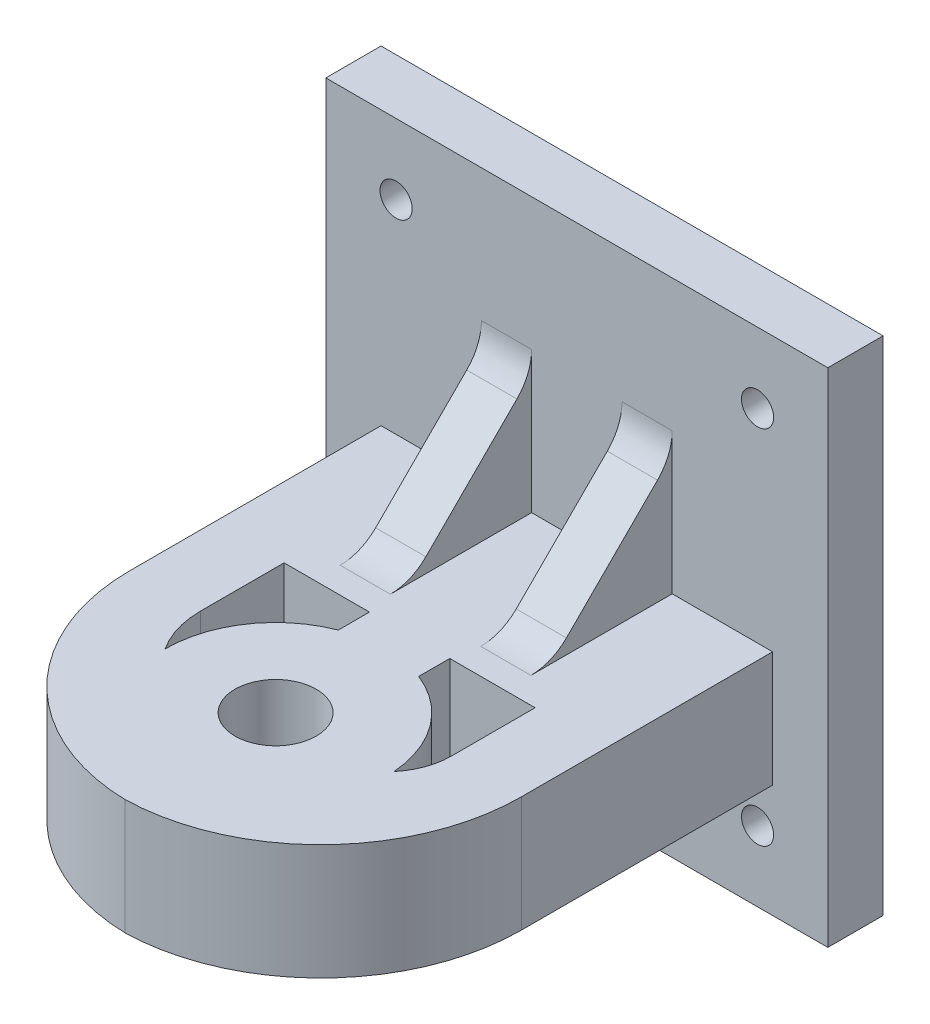
from build123d import *

# Parameters (mm, degrees)
SKETCH1_W           = 39
SKETCH1_H           = 45
BOSS_EXTRUDE1_DEPTH = 12.5
SKETCH2_R           = 4.05
CUT_EXTRUDE1_DEPTH  = 61.846117378
SKETCH3_W           = 50
SKETCH3_H           = 50
BOSS_EXTRUDE2_DEPTH = 5.5
BOSS_EXTRUDE3_START = -10
BOSS_EXTRUDE3_DEPTH = 5
LPATTERN1_COUNT     = 2
LPATTERN1_PITCH     = 14
FILLET1_R           = 5
SKETCH5_R           = 1.6
CUT_EXTRUDE2_DEPTH  = 79.17008699
FILLET2_R           = 20
CUT_EXTRUDE3_DEPTH  = 73.615855707
CUT_EXTRUDE4_START  = -1
SKETCH7_W           = 39.2
SKETCH7_H           = 50.063664736
SKETCH7_R           = 11
SKETCH7_W_2         = 11
SKETCH7_H_2         = 11
CUT_EXTRUDE4_DEPTH  = 1
SKETCH8_W           = 25
SKETCH8_H           = 5
SKETCH8_W_2         = 5
SKETCH8_H_2         = 25
BOSS_EXTRUDE4_DEPTH = 0.5


with BuildPart() as part:
    # Sketch1 → Boss-Extrude1 (new body)
    with BuildSketch(Plane(origin=(0, 0, 0), x_dir=(1, 0, 0), z_dir=(0, 1, 0))):
        with Locations((19.5, 22.5)):
            Rectangle(SKETCH1_W, SKETCH1_H)
    extrude(amount=BOSS_EXTRUDE1_DEPTH)

    # Sketch2 → Cut-Extrude1 (cut, through all)
    with BuildSketch(Plane(origin=(0, 12.5, 0), x_dir=(1, 0, 0), z_dir=(0, 1, 0))):
        with Locations(Location((19.5, 15, 0), (0, 0, 270))):
            Circle(SKETCH2_R)
    extrude(amount=-CUT_EXTRUDE1_DEPTH, mode=Mode.SUBTRACT)

    # Sketch3 → Boss-Extrude2 (add)
    with BuildSketch(Plane(origin=(0, 0, -45), x_dir=(-1, 0, 0), z_dir=(0, 0, -1))):
        with Locations((-19.5, 14.75)):
            Rectangle(SKETCH3_W, SKETCH3_H)
    extrude(amount=BOSS_EXTRUDE2_DEPTH)

    # Sketch4 → Boss-Extrude3 (add)
    with BuildSketch(Plane(origin=(39, 0, 0), x_dir=(0, 0, -1), z_dir=(1, 0, 0)).offset(BOSS_EXTRUDE3_START)):
        Polygon((33, 12.5), (45, 24.5), (45, 12.5), align=None)
    boss_extrude3 = extrude(amount=-BOSS_EXTRUDE3_DEPTH)

    # LPattern1: Boss-Extrude3 ×2
    with Locations(*[(-i * LPATTERN1_PITCH, 0, 0) for i in range(1, LPATTERN1_COUNT)]):
        add(boss_extrude3)

    # Fillet1
    fillet1_edges = [part.edges().sort_by_distance(p)[0] for p in [
        (26.5, 12.5, -33),
        (26.5, 24.5, -45),
        (12.5, 12.5, -33),
        (12.5, 24.5, -45),
    ]]
    fillet(fillet1_edges, radius=FILLET1_R)

    # Sketch5 → Cut-Extrude2 (cut, through all)
    with BuildSketch(Plane(origin=(0, 0, -50.5), x_dir=(-1, 0, 0), z_dir=(0, 0, -1))):
        with Locations((-37.5, 32.75)):
            Circle(SKETCH5_R)
        with Locations((-1.5, 32.75)):
            Circle(SKETCH5_R)
        with Locations((-1.5, -3.25)):
            Circle(SKETCH5_R)
        with Locations((-37.5, -3.25)):
            Circle(SKETCH5_R)
    extrude(amount=-CUT_EXTRUDE2_DEPTH, mode=Mode.SUBTRACT)

    # Fillet2
    # the kernel refuses this fillet: 20 mm, written as the material it takes off along each edge
    with BuildSketch(Plane(origin=(0, -50, 0), x_dir=(0, 0, -1), z_dir=(0, 1, 0))) as fillet2_piece_1:
        with BuildLine():
            CenterArc((FILLET2_R, -FILLET2_R), FILLET2_R, 90, 90)
            Line((0, -FILLET2_R), (0, 0))
            Line((0, 0), (FILLET2_R, 0))
        make_face()
    extrude(amount=112.5, mode=Mode.SUBTRACT)
    with BuildSketch(Plane(origin=(39, -50, 0), x_dir=(0, 0, -1), z_dir=(0, 1, 0))) as fillet2_piece_2:
        with BuildLine():
            CenterArc((FILLET2_R, FILLET2_R), FILLET2_R, 180, 90)
            Line((0, FILLET2_R), (0, 0))
            Line((0, 0), (FILLET2_R, 0))
        make_face()
    extrude(amount=112.5, mode=Mode.SUBTRACT)

    # Sketch6 → Cut-Extrude3 (cut, through all)
    with BuildSketch(Plane(origin=(0, 12.5, 0), x_dir=(1, 0, 0), z_dir=(0, 1, 0))):
        with BuildLine():
            Line((7, 20), (7, 28.347560338))
            Line((7, 28.347560338), (15.5, 28.347560338))
            Line((15.5, 28.347560338), (15.5, 25.246950766))
            ThreePointArc((15.5, 25.246950766), (10.417048938, 21.204836823), (8.5, 15))
            ThreePointArc((8.5, 15), (7.383077909, 17.389923373), (7, 20))
        make_face()
        with BuildLine():
            Line((23.5, 25.246950766), (23.5, 28.347560338))
            Line((23.5, 28.347560338), (32, 28.347560338))
            Line((32, 28.347560338), (32, 20))
            ThreePointArc((32, 20), (31.605614865, 17.768951725), (30.47026085, 15.808317311))
            ThreePointArc((30.47026085, 15.808317311), (28.348679441, 21.534590434), (23.5, 25.246950766))
        make_face()
    extrude(amount=-CUT_EXTRUDE3_DEPTH, mode=Mode.SUBTRACT)

    # Sketch7 → Cut-Extrude4 (cut)
    with BuildSketch(Plane.XZ.offset(CUT_EXTRUDE4_START)):
        with Locations((19.5, -19.968167632)):
            Rectangle(SKETCH7_W, SKETCH7_H)
        with Locations(Location((19.5, -15, 0), (0, 0, 180))):
            Circle(SKETCH7_R, mode=Mode.SUBTRACT)
        with Locations((10, -37.501795484)):
            Rectangle(SKETCH7_W_2, SKETCH7_H_2, mode=Mode.SUBTRACT)
        with Locations((29, -37.501795484)):
            Rectangle(SKETCH7_W_2, SKETCH7_H_2, mode=Mode.SUBTRACT)
    extrude(amount=CUT_EXTRUDE4_DEPTH, mode=Mode.SUBTRACT)

    # Sketch8 → Boss-Extrude4 (add)
    with BuildSketch(Plane(origin=(0, 0, -50.5), x_dir=(-1, 0, 0), z_dir=(0, 0, -1))):
        with Locations((-19.5, 32.75)):
            Rectangle(SKETCH8_W, SKETCH8_H)
        with Locations((-1.5, 14.75)):
            Rectangle(SKETCH8_W_2, SKETCH8_H_2)
        with Locations((-19.5, -3.25)):
            Rectangle(SKETCH8_W, SKETCH8_H)
        with Locations((-37.5, 14.75)):
            Rectangle(SKETCH8_W_2, SKETCH8_H_2)
    extrude(amount=BOSS_EXTRUDE4_DEPTH)


solid = part.part
